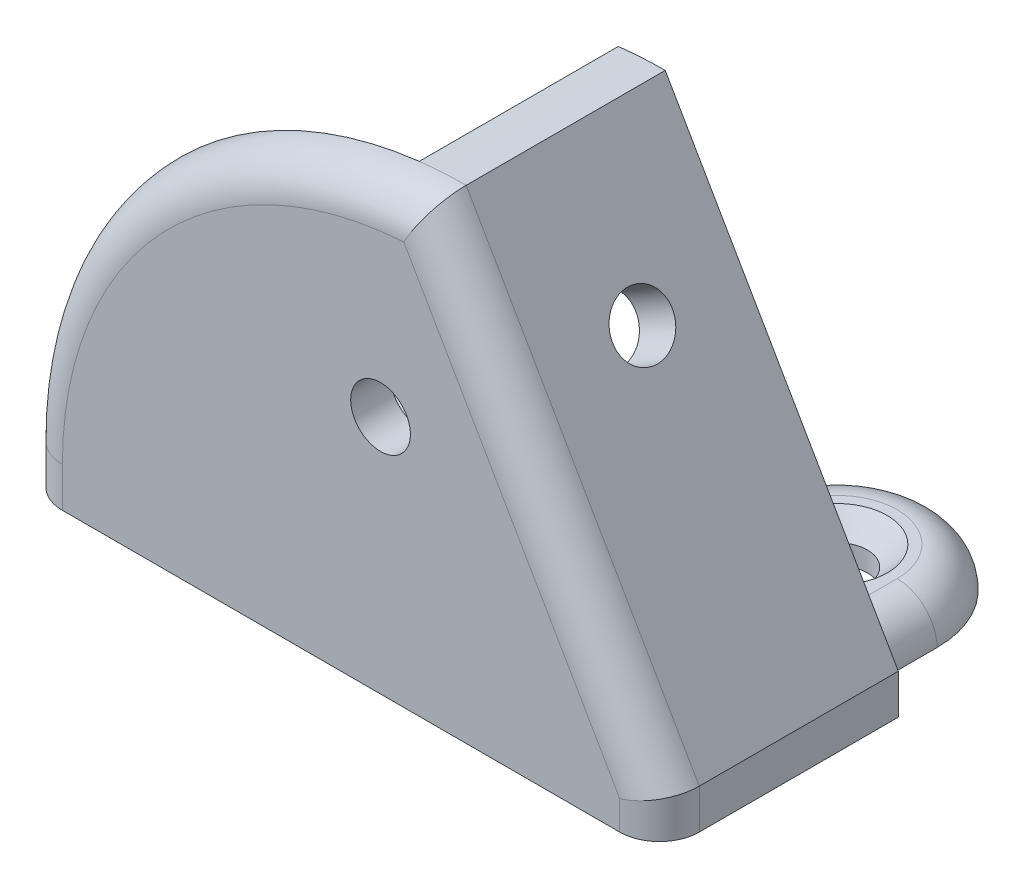
from build123d import *

# Parameters (mm, degrees)
BOSS_EXTRUDE1_DEPTH = 4
BOSS_EXTRUDE2_DEPTH = 20
SKETCH3_R           = 3
CUT_EXTRUDE1_DEPTH  = 62.345545492
SKETCH4_R           = 5
CUT_EXTRUDE2_DEPTH  = 65.381139123
SKETCH5_R           = 3
CUT_EXTRUDE3_DEPTH  = 81.725682082
SKETCH6_R           = 3
CUT_EXTRUDE4_DEPTH  = 80.48760808
SKETCH7_R           = 3
CUT_EXTRUDE5_DEPTH  = 81.516301651
BOSS_EXTRUDE3_DEPTH = 4
FILLET1_R           = 4
FILLET2_R           = 4


with BuildPart() as part:
    # Sketch1 → Boss-Extrude1 (new body)
    with BuildSketch(Plane.XY):
        with BuildLine():
            Line((0, 0), (0, 4))
            Line((0, 4), (-23.425625842, 44.574374158))
            ThreePointArc((-23.425625842, 44.574374158), (-52.116040952, 32.690415109), (-64, 4))
            Line((-64, 4), (-64, 0))
            Line((-64, 0), (0, 0))
        make_face()
    extrude(amount=-BOSS_EXTRUDE1_DEPTH)

    # Sketch2 → Boss-Extrude2 (add)
    with BuildSketch(Plane(origin=(0, 0, -4), x_dir=(-1, 0, 0), z_dir=(0, 0, -1))):
        with BuildLine():
            Line((64, 4), (35.415278297, 4))
            ThreePointArc((35.415278297, 4), (31.691369061, 6.15), (31.691369061, 10.45))
            Line((31.691369061, 10.45), (14.370860985, 20.45))
            Line((14.370860985, 20.45), (28.140384731, 44.299514723))
            ThreePointArc((28.140384731, 44.299514723), (25.787007804, 44.505601014), (23.425625842, 44.574374158))
            Line((23.425625842, 44.574374158), (0, 4))
            Line((0, 4), (0, 0))
            Line((0, 0), (64, 0))
            Line((64, 0), (64, 4))
        make_face()
    extrude(amount=BOSS_EXTRUDE2_DEPTH)

    # Sketch3 → Cut-Extrude1 (cut, through all)
    with BuildSketch(Plane(origin=(-12.447825, 21.560265344, 0), x_dir=(0.8660254037844387, 0.49999999999999983, 0), z_dir=(-0.49999999999999983, 0.8660254037844387, 0))):
        with Locations(Location((-12.220530687, 14, 0), (0, 0, 180))):
            Circle(SKETCH3_R)
    extrude(amount=-CUT_EXTRUDE1_DEPTH, mode=Mode.SUBTRACT)

    # Sketch4 → Cut-Extrude2 (cut, through all)
    with BuildSketch(Plane(origin=(-10.447825, 18.096163729, 0), x_dir=(-0.8660254037844387, -0.49999999999999983, 0), z_dir=(-0.49999999999999983, 0.8660254037844387, 0))):
        with Locations((12.220530687, -14)):
            Circle(SKETCH4_R)
    extrude(amount=-CUT_EXTRUDE2_DEPTH, mode=Mode.SUBTRACT)

    # Sketch5 → Cut-Extrude3 (cut, through all)
    with BuildSketch(Plane(origin=(-1.923035985, -1.110265344, 0), x_dir=(0, 0, 1), z_dir=(-0.8660254037844386, -0.5000000000000001, 0))):
        with Locations(Location((-14, 34.89565, 0), (0, 0, 270))):
            Circle(SKETCH5_R)
    extrude(amount=-CUT_EXTRUDE3_DEPTH, mode=Mode.SUBTRACT)

    # Sketch6 → Cut-Extrude4 (cut, through all)
    with BuildSketch(Plane(origin=(0, 4, 0), x_dir=(1, 0, 0), z_dir=(0, 1, 0))):
        with Locations(Location((-52, 14, 0), (0, 0, 180))):
            Circle(SKETCH6_R)
    extrude(amount=-CUT_EXTRUDE4_DEPTH, mode=Mode.SUBTRACT)

    # Sketch7 → Cut-Extrude5 (cut, through all)
    with BuildSketch(Plane(origin=(0, 0, -4), x_dir=(-1, 0, 0), z_dir=(0, 0, -1))):
        with Locations((28.031115023, 24.110254038)):
            Circle(SKETCH7_R)
    extrude(amount=-CUT_EXTRUDE5_DEPTH, mode=Mode.SUBTRACT)

    # Sketch8 → Boss-Extrude3 (add)
    with BuildSketch(Plane(origin=(0, 0, 0), x_dir=(1, 0, 0), z_dir=(0, 1, 0))):
        with BuildLine():
            Line((-24.111053364, 24), (-4.111053364, 24))
            Line((-4.111053364, 24), (-4.111053364, 32))
            ThreePointArc((-4.111053364, 32), (-14.111053364, 42), (-24.111053364, 32))
            Line((-24.111053364, 32), (-24.111053364, 24))
        make_face()
    extrude(amount=BOSS_EXTRUDE3_DEPTH)

    # Sketch9 → Cut-Revolve2 (revolve, cut)
    with BuildSketch(Plane.XY.offset(-32), mode=Mode.PRIVATE) as cut_revolve2_sk:
        Polygon((-17.111053364, 0), (-17.111053364, 2), (-19.111053364, 4), (-14.111053364, 4), (-14.111053364, 0), align=None)
    revolve(cut_revolve2_sk.sketch.rotate(Axis((-14.111053364, 4, -32), (0, -1, 0)), 270), axis=Axis((-14.111053364, 4, -32), (0, -1, 0)), mode=Mode.SUBTRACT)

    # Fillet1
    fillet1_edges = [part.edges().sort_by_distance(p)[0] for p in [
        (-24.111053364, 4, -28),
        (-14.111053364, 4, -42),
        (-4.111053364, 4, -28),
    ]]
    fillet(fillet1_edges, radius=FILLET1_R - 0.0001)  # a hair under: the kernel refuses the full size

    # Fillet2
    fillet2_edges = [part.edges().sort_by_distance(p)[0] for p in [
        (-64, 2, 0),
        (0, 2, 0),
        (-11.712812921, 24.287187079, 0),
        (-52.116040952, 32.690415109, 0),
    ]]
    fillet(fillet2_edges, radius=FILLET2_R - 0.0001)  # a hair under: the kernel refuses the full size


solid = part.part
